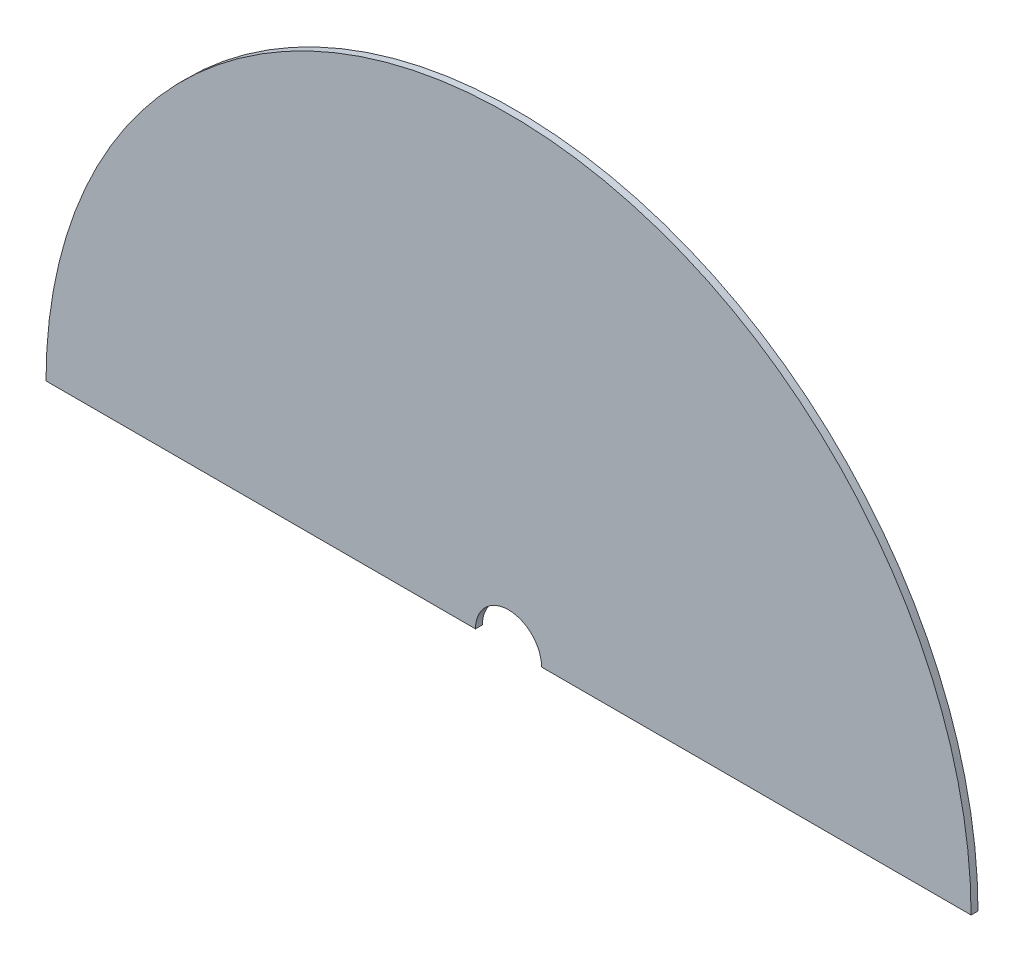
from build123d import *

# Parameters (mm, degrees)
BASE_FLANGE1_DEPTH = 2.65684


# Sheet-metal steps are written as plain solids
with BuildPart() as part:
    # Sketch1 → Base-Flange1 (new body)
    with BuildSketch(Plane.XY):
        with BuildLine():
            Line((-177.8, 0), (-12.7, 0))
            ThreePointArc((-12.7, 0), (0, 12.7), (12.7, 0))
            Line((12.7, 0), (177.8, 0))
            ThreePointArc((177.8, 0), (125.723585695, 125.723585695), (0, 177.8))
            ThreePointArc((0, 177.8), (-125.723585695, 125.723585695), (-177.8, 0))
        make_face()
    extrude(amount=-BASE_FLANGE1_DEPTH)


solid = part.part
